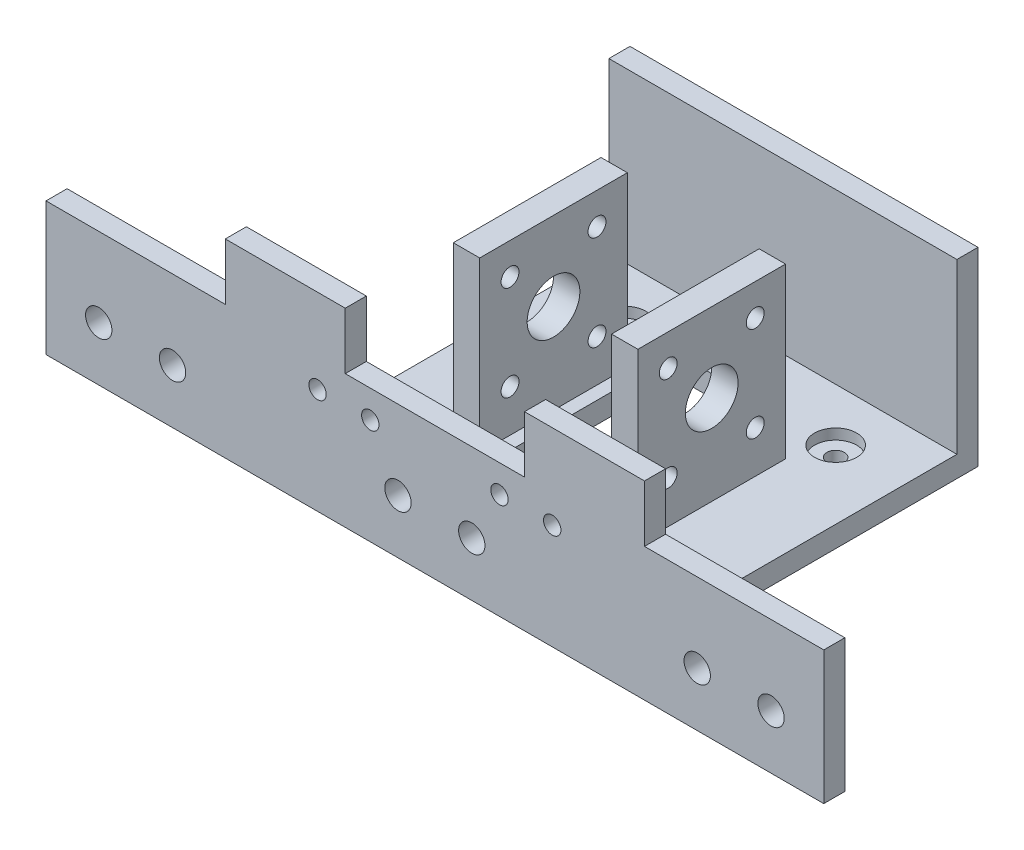
from build123d import *

# Parameters (mm, degrees)
SKETCH1_W                 = 75
SKETCH1_H                 = 40
SKETCH1_R                 = 5
SKETCH1_R_2               = 1.7
SKETCH1_W_2               = 10
SKETCH1_H_2               = 20
BOSS_EXTRUDE1_DEPTH       = 3
CUT_EXTRUDE1_DEPTH        = 43.605750786
CUT_EXTRUDE1_DEPTH_BACK   = 43.605750786
SKETCH2_W                 = 67
SKETCH2_H                 = 28
BOSS_EXTRUDE3_DEPTH       = 110
BOSS_EXTRUDE3_DEPTH_BACK  = 3
SKETCH3_W                 = 75
SKETCH3_H                 = 70
SKETCH3_W_2               = 67
SKETCH3_H_2               = 40
SKETCH6_W                 = 67
SKETCH6_H                 = 11
CUT_EXTRUDE4_DEPTH        = 122.372360939
SKETCH7_W                 = 70
SKETCH7_H                 = 37
BOSS_EXTRUDE4_DEPTH       = 45
SKETCH8_W                 = 45
SKETCH8_H                 = 62
CUT_EXTRUDE6_DEPTH        = 29
SKETCH11_W                = 45
SKETCH11_H                = 4
CUT_EXTRUDE9_DEPTH        = 157.445677473
SKETCH9_W                 = 38
SKETCH9_H                 = 28.5
CUT_EXTRUDE10_DEPTH       = 204.024629048
SKETCH13_W                = 5
SKETCH13_H                = 38
BOSS_EXTRUDE5_DEPTH       = 32
SKETCH14_R                = 5
SKETCH14_R_2              = 1.7
CUT_EXTRUDE11_DEPTH       = 32
SKETCH15_W                = 165
SKETCH15_H                = 70
SKETCH15_W_2              = 157
SKETCH15_H_2              = 62
BOSS_EXTRUDE6_DEPTH       = 3
SKETCH16_W                = 20
SKETCH16_H                = 4.820648258
CUT_EXTRUDE12_DEPTH       = 159.626132778
SKETCH18_R                = 1.65
CUT_EXTRUDE14_DEPTH       = 159.626132778
MIRROR6_COPY_1_SKETCH_W   = 5
MIRROR6_COPY_1_SKETCH_H   = 38
MIRROR6_COPY_1_DEPTH      = 32
MIRROR6_COPY_2_SKETCH_R   = 5
MIRROR6_COPY_2_SKETCH_R_2 = 1.7
MIRROR6_COPY_2_DEPTH      = 32
MIRROR6_COPY_3_SKETCH_W   = 5
MIRROR6_COPY_3_SKETCH_H   = 38
MIRROR6_COPY_3_DEPTH      = 32
MIRROR6_COPY_4_SKETCH_R   = 5
MIRROR6_COPY_4_SKETCH_R_2 = 1.7
MIRROR6_COPY_4_DEPTH      = 32
SKETCH19_W                = 38
SKETCH19_H                = 3.5
CUT_EXTRUDE15_DEPTH       = 10
SKETCH20_R                = 1.2
CUT_EXTRUDE16_DEPTH       = 10
SKETCH21_W                = 10
SKETCH21_H                = 80
CUT_EXTRUDE17_DEPTH       = 184.330984833
SKETCH22_W                = 55
SKETCH22_H                = 80
CUT_EXTRUDE18_DEPTH       = 184.330984833
SKETCH23_W                = 67
SKETCH23_H                = 62
BOSS_EXTRUDE7_DEPTH       = 4
SKETCH24_R                = 10
SKETCH24_R_2              = 1.65
CUT_EXTRUDE19_DEPTH       = 111.123793978
CUT_EXTRUDE21_START       = -16
SKETCH25_R                = 1.65
CUT_EXTRUDE21_DEPTH       = 16
SKETCH26_W                = 14.5
SKETCH26_H                = 36
CUT_EXTRUDE22_DEPTH       = 178.837706913
SKETCH27_W                = 5
SKETCH27_H                = 64
CUT_EXTRUDE23_DEPTH       = 43
CUT_EXTRUDE24_DEPTH       = 100.724620832
SKETCH29_R                = 4
SKETCH29_R_2              = 1.65
CUT_EXTRUDE25_DEPTH       = 2
SKETCH30_W                = 5
SKETCH30_H                = 28
BOSS_EXTRUDE8_DEPTH       = 32
CUT_EXTRUDE26_START       = -32
SKETCH32_R                = 5
SKETCH32_R_2              = 1.7
CUT_EXTRUDE26_DEPTH       = 32
CUT_EXTRUDE27_DEPTH       = 32
SKETCH36_R                = 1.65
CUT_EXTRUDE28_DEPTH       = 10
SKETCH37_W                = 6.586786374
SKETCH37_H                = 6.17536381
BOSS_EXTRUDE9_DEPTH       = 4
SKETCH38_W                = 28.25
SKETCH38_H                = 10.75
CUT_EXTRUDE29_DEPTH       = 10
SKETCH39_W                = 5.75
SKETCH39_H                = 25.25
BOSS_EXTRUDE10_DEPTH      = 4
SKETCH40_W                = 34
SKETCH40_H                = 10.75
CUT_EXTRUDE30_DEPTH       = 10
SKETCH41_R                = 2.5
CUT_EXTRUDE31_DEPTH       = 10


with BuildPart() as part:
    # Sketch1 → Boss-Extrude1 (new body)
    with BuildSketch(Plane(origin=(0, 0, 0), x_dir=(1, 0, 0), z_dir=(0, 1, 0))):
        Rectangle(SKETCH1_W, SKETCH1_H)
        with Locations((-21, 0)):
            Circle(SKETCH1_R, mode=Mode.SUBTRACT)
        with Locations((-30, 8.25)):
            Circle(SKETCH1_R_2, mode=Mode.SUBTRACT)
        with Locations((-12, 8.25)):
            Circle(SKETCH1_R_2, mode=Mode.SUBTRACT)
        with Locations((-12, -8.25)):
            Circle(SKETCH1_R_2, mode=Mode.SUBTRACT)
        with Locations((-30, -8.25)):
            Circle(SKETCH1_R_2, mode=Mode.SUBTRACT)
        with Locations((12, 8.25)):
            Circle(SKETCH1_R_2, mode=Mode.SUBTRACT)
        with Locations((12, -8.25)):
            Circle(SKETCH1_R_2, mode=Mode.SUBTRACT)
        with Locations((21, 0)):
            Circle(SKETCH1_R, mode=Mode.SUBTRACT)
        with Locations((30, -8.25)):
            Circle(SKETCH1_R_2, mode=Mode.SUBTRACT)
        with Locations((30, 8.25)):
            Circle(SKETCH1_R_2, mode=Mode.SUBTRACT)
        Rectangle(SKETCH1_W_2, SKETCH1_H_2, mode=Mode.SUBTRACT)
    extrude(amount=BOSS_EXTRUDE1_DEPTH)

    # Sketch2 → Cut-Extrude1 (cut, two sides: drawn at the far end of the back side and taken through both)
    with BuildSketch(Plane(origin=(0, 3, 0), x_dir=(1, 0, 0), z_dir=(0, 1, 0)).offset(-CUT_EXTRUDE1_DEPTH_BACK)):
        Rectangle(SKETCH2_W, SKETCH2_H)
    extrude(amount=CUT_EXTRUDE1_DEPTH + CUT_EXTRUDE1_DEPTH_BACK, mode=Mode.SUBTRACT)

    # Sketch3 → Boss-Extrude3 (add, two sides: drawn at the far end of the back side and taken through both)
    with BuildSketch(Plane(origin=(0, 3, 0), x_dir=(1, 0, 0), z_dir=(0, 1, 0)).offset(-BOSS_EXTRUDE3_DEPTH_BACK)):
        Rectangle(SKETCH3_W, SKETCH3_H)
        Rectangle(SKETCH3_W_2, SKETCH3_H_2, mode=Mode.SUBTRACT)
    extrude(amount=BOSS_EXTRUDE3_DEPTH + BOSS_EXTRUDE3_DEPTH_BACK)

    # Sketch6 → Cut-Extrude4 (cut, through all)
    with BuildSketch(Plane(origin=(0, 3, 0), x_dir=(1, 0, 0), z_dir=(0, 1, 0))):
        with Locations((0, -25.5)):
            Rectangle(SKETCH6_W, SKETCH6_H)
        with Locations((0, 25.5)):
            Rectangle(SKETCH6_W, SKETCH6_H)
    extrude(amount=CUT_EXTRUDE4_DEPTH, mode=Mode.SUBTRACT)

    # Sketch7 → Boss-Extrude4 (add)
    with BuildSketch(Plane.ZY.offset(37.5)):
        with Locations((0, 94.5)):
            Rectangle(SKETCH7_W, SKETCH7_H)
    boss_extrude4 = extrude(amount=BOSS_EXTRUDE4_DEPTH)

    # Mirror2: Boss-Extrude4 across plane
    add(boss_extrude4.mirror(Plane(origin=(0, 0, 0), x_dir=(0, 0, 1), z_dir=(1, 0, 0))))

    # Sketch8 → Cut-Extrude6 (cut)
    with BuildSketch(Plane(origin=(0, 113, 0), x_dir=(1, 0, 0), z_dir=(0, 1, 0))):
        with Locations((-56, 0)):
            Rectangle(SKETCH8_W, SKETCH8_H)
        with Locations((56, 0)):
            Rectangle(SKETCH8_W, SKETCH8_H)
    extrude(amount=-CUT_EXTRUDE6_DEPTH, mode=Mode.SUBTRACT)

    # Sketch11 → Cut-Extrude9 (cut, through all)
    with BuildSketch(Plane.XY.offset(35)):
        with Locations((-60, 78)):
            Rectangle(SKETCH11_W, SKETCH11_H)
        with Locations((60, 78)):
            Rectangle(SKETCH11_W, SKETCH11_H)
    extrude(amount=-CUT_EXTRUDE9_DEPTH, mode=Mode.SUBTRACT)

    # Sketch9 → Cut-Extrude10 (cut, through all)
    with BuildSketch(Plane.ZY.offset(82.5)):
        with Locations((0, 98.25)):
            Rectangle(SKETCH9_W, SKETCH9_H)
    extrude(amount=-CUT_EXTRUDE10_DEPTH, mode=Mode.SUBTRACT)

    # Sketch13 → Boss-Extrude5 (add)
    with BuildSketch(Plane(origin=(0, 84, 0), x_dir=(1, 0, 0), z_dir=(0, 1, 0))):
        with Locations((-39, 0)):
            Rectangle(SKETCH13_W, SKETCH13_H)
    boss_extrude5 = extrude(amount=BOSS_EXTRUDE5_DEPTH)

    # Sketch14 → Cut-Extrude11 (cut)
    with BuildSketch(Plane.ZY.offset(41.5)):
        with Locations((0, 101)):
            Circle(SKETCH14_R)
        with Locations((-8.25, 110)):
            Circle(SKETCH14_R_2)
        with Locations((8.25, 110)):
            Circle(SKETCH14_R_2)
        with Locations((8.25, 92)):
            Circle(SKETCH14_R_2)
        with Locations((-8.25, 92)):
            Circle(SKETCH14_R_2)
    cut_extrude11 = extrude(amount=-CUT_EXTRUDE11_DEPTH, mode=Mode.SUBTRACT)

    # Mirror4: Boss-Extrude5, Cut-Extrude11 across plane
    add(boss_extrude5.mirror(Plane(origin=(0, 0, 0), x_dir=(0, 0, 1), z_dir=(1, 0, 0))))
    add(cut_extrude11.mirror(Plane(origin=(0, 0, 0), x_dir=(0, 0, 1), z_dir=(1, 0, 0))), mode=Mode.SUBTRACT)

    # Sketch15 → Boss-Extrude6 (add)
    with BuildSketch(Plane(origin=(0, 113, 0), x_dir=(1, 0, 0), z_dir=(0, 1, 0))):
        Rectangle(SKETCH15_W, SKETCH15_H)
        Rectangle(SKETCH15_W_2, SKETCH15_H_2, mode=Mode.SUBTRACT)
    extrude(amount=BOSS_EXTRUDE6_DEPTH)

    # Sketch16 → Cut-Extrude12 (cut, through all)
    with BuildSketch(Plane.XY.offset(35)):
        with Locations((0, 11.636111214)):
            Rectangle(SKETCH16_W, SKETCH16_H)
    extrude(amount=-CUT_EXTRUDE12_DEPTH, mode=Mode.SUBTRACT)

    # Sketch18 → Cut-Extrude14 (cut, through all)
    with BuildSketch(Plane.XY.offset(35)):
        with Locations((52.25, 100)):
            Circle(SKETCH18_R)
    cut_extrude14 = extrude(amount=-CUT_EXTRUDE14_DEPTH, mode=Mode.SUBTRACT)

    # Mirror5: Cut-Extrude14 across plane
    add(cut_extrude14.mirror(Plane(origin=(0, 0, 0), x_dir=(0, 0, 1), z_dir=(1, 0, 0))), mode=Mode.SUBTRACT)

    # Mirror6 copy 1 sketch → Mirror6 copy 1 (add)
    with BuildSketch(Plane(origin=(0, 148, 0), x_dir=(-1, 0, 0), z_dir=(0, -1, 0))):
        with Locations((-39, 0)):
            Rectangle(MIRROR6_COPY_1_SKETCH_W, MIRROR6_COPY_1_SKETCH_H)
    extrude(amount=MIRROR6_COPY_1_DEPTH)

    # Mirror6 copy 2 sketch → Mirror6 copy 2 (cut)
    with BuildSketch(Plane(origin=(41.5, 232, 0), x_dir=(0, 0, 1), z_dir=(1, 0, 0))):
        with Locations((0, 101)):
            Circle(MIRROR6_COPY_2_SKETCH_R)
        with Locations((-8.25, 110)):
            Circle(MIRROR6_COPY_2_SKETCH_R_2)
        with Locations((8.25, 110)):
            Circle(MIRROR6_COPY_2_SKETCH_R_2)
        with Locations((8.25, 92)):
            Circle(MIRROR6_COPY_2_SKETCH_R_2)
        with Locations((-8.25, 92)):
            Circle(MIRROR6_COPY_2_SKETCH_R_2)
    extrude(amount=-MIRROR6_COPY_2_DEPTH, mode=Mode.SUBTRACT)

    # Mirror6 copy 3 sketch → Mirror6 copy 3 (add)
    with BuildSketch(Plane.XZ.offset(-148)):
        with Locations((-39, 0)):
            Rectangle(MIRROR6_COPY_3_SKETCH_W, MIRROR6_COPY_3_SKETCH_H)
    extrude(amount=MIRROR6_COPY_3_DEPTH)

    # Mirror6 copy 4 sketch → Mirror6 copy 4 (cut)
    with BuildSketch(Plane(origin=(-41.5, 232, 0), x_dir=(0, 0, 1), z_dir=(-1, 0, 0))):
        with Locations((0, -101)):
            Circle(MIRROR6_COPY_4_SKETCH_R)
        with Locations((-8.25, -110)):
            Circle(MIRROR6_COPY_4_SKETCH_R_2)
        with Locations((8.25, -110)):
            Circle(MIRROR6_COPY_4_SKETCH_R_2)
        with Locations((8.25, -92)):
            Circle(MIRROR6_COPY_4_SKETCH_R_2)
        with Locations((-8.25, -92)):
            Circle(MIRROR6_COPY_4_SKETCH_R_2)
    extrude(amount=-MIRROR6_COPY_4_DEPTH, mode=Mode.SUBTRACT)

    # Sketch19 → Cut-Extrude15 (cut)
    with BuildSketch(Plane(origin=(82.5, 0, 0), x_dir=(0, 0, -1), z_dir=(1, 0, 0))):
        with Locations((0, 114.25)):
            Rectangle(SKETCH19_W, SKETCH19_H)
    cut_extrude15 = extrude(amount=-CUT_EXTRUDE15_DEPTH, mode=Mode.SUBTRACT)

    # Mirror7: Cut-Extrude15 across plane
    add(cut_extrude15.mirror(Plane(origin=(0, 0, 0), x_dir=(0, 0, 1), z_dir=(1, 0, 0))), mode=Mode.SUBTRACT)

    # Sketch20 → Cut-Extrude16 (cut)
    with BuildSketch(Plane(origin=(0, 3, 0), x_dir=(1, 0, 0), z_dir=(0, 1, 0))):
        with Locations((-12, 17.5)):
            Circle(SKETCH20_R)
        with Locations((-12, -17.5)):
            Circle(SKETCH20_R)
        with Locations((-24, -17.5)):
            Circle(SKETCH20_R)
        with Locations((-24, 17.5)):
            Circle(SKETCH20_R)
        with Locations((12, -17.5)):
            Circle(SKETCH20_R)
        with Locations((24, -17.5)):
            Circle(SKETCH20_R)
        with Locations((12, 17.5)):
            Circle(SKETCH20_R)
        with Locations((24, 17.5)):
            Circle(SKETCH20_R)
    extrude(amount=-CUT_EXTRUDE16_DEPTH, mode=Mode.SUBTRACT)

    # Sketch21 → Cut-Extrude17 (cut, through all)
    with BuildSketch(Plane.XY.offset(35)):
        with Locations((32.5, 40)):
            Rectangle(SKETCH21_W, SKETCH21_H)
        with Locations((-32.5, 40)):
            Rectangle(SKETCH21_W, SKETCH21_H)
    extrude(amount=-CUT_EXTRUDE17_DEPTH, mode=Mode.SUBTRACT)

    # Sketch22 → Cut-Extrude18 (cut, through all)
    with BuildSketch(Plane.XY.offset(35)):
        with Locations((0, 40)):
            Rectangle(SKETCH22_W, SKETCH22_H)
    extrude(amount=-CUT_EXTRUDE18_DEPTH, mode=Mode.SUBTRACT)

    # Sketch23 → Boss-Extrude7 (add)
    with BuildSketch(Plane.XZ.offset(-80)):
        Rectangle(SKETCH23_W, SKETCH23_H)
    extrude(amount=-BOSS_EXTRUDE7_DEPTH)

    # Sketch24 → Cut-Extrude19 (cut, through all)
    with BuildSketch(Plane(origin=(0, 84, 0), x_dir=(1, 0, 0), z_dir=(0, 1, 0))):
        Circle(SKETCH24_R)
        with Locations((-20, 21)):
            Circle(SKETCH24_R_2)
        with Locations((-20, -21)):
            Circle(SKETCH24_R_2)
        with Locations((20, -21)):
            Circle(SKETCH24_R_2)
        with Locations((20, 21)):
            Circle(SKETCH24_R_2)
    extrude(amount=-CUT_EXTRUDE19_DEPTH, mode=Mode.SUBTRACT)

    # Sketch25 → Cut-Extrude21 (cut)
    with BuildSketch(Plane(origin=(0, 0, -35), x_dir=(-1, 0, 0), z_dir=(0, 0, -1)).offset(CUT_EXTRUDE21_START)):
        Polygon((33.5, 116), (33.5, 84), (33.5, 80), (82.5, 80), (82.5, 116), align=None)
        with Locations((52.25, 100)):
            Circle(SKETCH25_R, mode=Mode.SUBTRACT)
    cut_extrude21 = extrude(amount=CUT_EXTRUDE21_DEPTH, mode=Mode.SUBTRACT)

    # Mirror8: Cut-Extrude21 across plane
    add(cut_extrude21.mirror(Plane(origin=(0, 0, 0), x_dir=(0, 0, 1), z_dir=(1, 0, 0))), mode=Mode.SUBTRACT)

    # Sketch26 → Cut-Extrude22 (cut, through all)
    with BuildSketch(Plane(origin=(0, 0, -19), x_dir=(-1, 0, 0), z_dir=(0, 0, -1))):
        with Locations((75.25, 98)):
            Rectangle(SKETCH26_W, SKETCH26_H)
    cut_extrude22 = extrude(amount=-CUT_EXTRUDE22_DEPTH, mode=Mode.SUBTRACT)

    # Mirror9: Cut-Extrude22 across plane
    add(cut_extrude22.mirror(Plane(origin=(0, 0, 0), x_dir=(0, 0, 1), z_dir=(1, 0, 0))), mode=Mode.SUBTRACT)

    # Sketch27 → Cut-Extrude23 (cut)
    with BuildSketch(Plane(origin=(0, 0, -19), x_dir=(-1, 0, 0), z_dir=(0, 0, -1))):
        with Locations((-39, 116)):
            Rectangle(SKETCH27_W, SKETCH27_H)
    extrude(amount=-CUT_EXTRUDE23_DEPTH, mode=Mode.SUBTRACT)

    # Sketch28 → Cut-Extrude24 (cut, symmetric)
    with BuildSketch(Plane(origin=(0, 84, 0), x_dir=(1, 0, 0), z_dir=(0, 1, 0))):
        Polygon((68, 19), (33.5, 19), (33.5, 35), (33, 35), (33, 19), (33, -31), (68, -31), align=None)
    cut_extrude24 = extrude(amount=CUT_EXTRUDE24_DEPTH, both=True, mode=Mode.SUBTRACT)

    # Sketch29 → Cut-Extrude25 (cut)
    # profile 1 of 4: a face of its own
    with BuildSketch(Plane(origin=(0, 84, 0), x_dir=(1, 0, 0), z_dir=(0, 1, 0))):
        with Locations((-20, 21)):
            Circle(SKETCH29_R)
        with Locations((-20, 21)):
            Circle(SKETCH29_R_2, mode=Mode.SUBTRACT)
    # profile 2 of 4: a face of its own
    with BuildSketch(Plane(origin=(0, 84, 0), x_dir=(1, 0, 0), z_dir=(0, 1, 0))):
        with Locations((20, 21)):
            Circle(SKETCH29_R)
        with Locations((20, 21)):
            Circle(SKETCH29_R_2, mode=Mode.SUBTRACT)
    # profile 3 of 4: a face of its own
    with BuildSketch(Plane(origin=(0, 84, 0), x_dir=(1, 0, 0), z_dir=(0, 1, 0))):
        with Locations((20, -21)):
            Circle(SKETCH29_R)
        with Locations((20, -21)):
            Circle(SKETCH29_R_2, mode=Mode.SUBTRACT)
    # profile 4 of 4: a face of its own
    with BuildSketch(Plane(origin=(0, 84, 0), x_dir=(1, 0, 0), z_dir=(0, 1, 0))):
        with Locations((-20, -21)):
            Circle(SKETCH29_R)
        with Locations((-20, -21)):
            Circle(SKETCH29_R_2, mode=Mode.SUBTRACT)
    extrude(amount=-CUT_EXTRUDE25_DEPTH, mode=Mode.SUBTRACT)

    # Sketch30 → Boss-Extrude8 (add)
    with BuildSketch(Plane(origin=(0, 84, 0), x_dir=(1, 0, 0), z_dir=(0, 1, 0))):
        with Locations((15, 0)):
            Rectangle(SKETCH30_W, SKETCH30_H)
    boss_extrude8 = extrude(amount=BOSS_EXTRUDE8_DEPTH)

    # Sketch32 → Cut-Extrude26 (cut)
    with BuildSketch(Plane(origin=(17.5, 0, 0), x_dir=(0, 0, -1), z_dir=(1, 0, 0)).offset(CUT_EXTRUDE26_START)):
        with Locations((0, 101)):
            Circle(SKETCH32_R)
        with Locations((8.25, 110)):
            Circle(SKETCH32_R_2)
        with Locations((-8.25, 110)):
            Circle(SKETCH32_R_2)
        with Locations((-8.25, 92)):
            Circle(SKETCH32_R_2)
        with Locations((8.25, 92)):
            Circle(SKETCH32_R_2)
    cut_extrude26 = extrude(amount=CUT_EXTRUDE26_DEPTH, mode=Mode.SUBTRACT)

    # Mirror11: Cut-Extrude24 across plane
    add(cut_extrude24.mirror(Plane(origin=(0, 0, 0), x_dir=(0, 0, 1), z_dir=(1, 0, 0))), mode=Mode.SUBTRACT)

    # Mirror16: Boss-Extrude8 across plane
    add(boss_extrude8.mirror(Plane(origin=(0, 0, 0), x_dir=(0, 0, 1), z_dir=(1, 0, 0))))

    # Mirror18: Cut-Extrude26 across plane
    add(cut_extrude26.mirror(Plane(origin=(0, 0, 0), x_dir=(0, 0, 1), z_dir=(1, 0, 0))), mode=Mode.SUBTRACT)

    # Sketch34 → Cut-Extrude27 (cut)
    with BuildSketch(Plane(origin=(0, 84, 0), x_dir=(1, 0, 0), z_dir=(0, 1, 0))):
        with BuildLine():
            ThreePointArc((10, 0), (0, -10), (-10, 0))
            Line((-10, 0), (-10, -21))
            Line((-10, -21), (10, -21))
            Line((10, -21), (10, 0))
        make_face()
        with BuildLine():
            Line((-10, 21), (-10, 0))
            ThreePointArc((-10, 0), (0, 10), (10, 0))
            Line((10, 0), (10, 21))
            Line((10, 21), (-10, 21))
        make_face()
    extrude(amount=-CUT_EXTRUDE27_DEPTH, mode=Mode.SUBTRACT)

    # Sketch36 → Cut-Extrude28 (cut)
    with BuildSketch(Plane.XY.offset(35)):
        with Locations((22.25, 100)):
            Circle(SKETCH36_R)
        with Locations((12.25, 100)):
            Circle(SKETCH36_R)
        with Locations((-12.25, 100)):
            Circle(SKETCH36_R)
        with Locations((-22.25, 100)):
            Circle(SKETCH36_R)
    extrude(amount=-CUT_EXTRUDE28_DEPTH, mode=Mode.SUBTRACT)

    # Sketch37 → Boss-Extrude9 (add)
    with BuildSketch(Plane.XY.offset(35)):
        with Locations((52.25, 100)):
            Rectangle(SKETCH37_W, SKETCH37_H)
        with Locations((-52.25, 100)):
            Rectangle(SKETCH37_W, SKETCH37_H)
    extrude(amount=-BOSS_EXTRUDE9_DEPTH)

    # Sketch38 → Cut-Extrude29 (cut)
    with BuildSketch(Plane.XY.offset(35)):
        with Locations((-53.875, 110.625)):
            Rectangle(SKETCH38_W, SKETCH38_H)
        with Locations((53.875, 110.625)):
            Rectangle(SKETCH38_W, SKETCH38_H)
    extrude(amount=-CUT_EXTRUDE29_DEPTH, mode=Mode.SUBTRACT)

    # Sketch39 → Boss-Extrude10 (add)
    with BuildSketch(Plane.XY.offset(35)):
        with Locations((-70.875, 92.625)):
            Rectangle(SKETCH39_W, SKETCH39_H)
        with Locations((70.875, 92.625)):
            Rectangle(SKETCH39_W, SKETCH39_H)
    extrude(amount=-BOSS_EXTRUDE10_DEPTH)

    # Sketch40 → Cut-Extrude30 (cut)
    with BuildSketch(Plane.XY.offset(35)):
        with Locations((0, 110.625)):
            Rectangle(SKETCH40_W, SKETCH40_H)
    extrude(amount=-CUT_EXTRUDE30_DEPTH, mode=Mode.SUBTRACT)

    # Sketch41 → Cut-Extrude31 (cut)
    with BuildSketch(Plane.XY.offset(35)):
        with Locations((63.75, 90.25)):
            Circle(SKETCH41_R)
        with Locations((49.75, 90.25)):
            Circle(SKETCH41_R)
        with Locations((7, 90.25)):
            Circle(SKETCH41_R)
        with Locations((-49.75, 90.25)):
            Circle(SKETCH41_R)
        with Locations((-63.75, 90.25)):
            Circle(SKETCH41_R)
        with Locations((-7, 90.25)):
            Circle(SKETCH41_R)
    extrude(amount=-CUT_EXTRUDE31_DEPTH, mode=Mode.SUBTRACT)


solid = part.part
